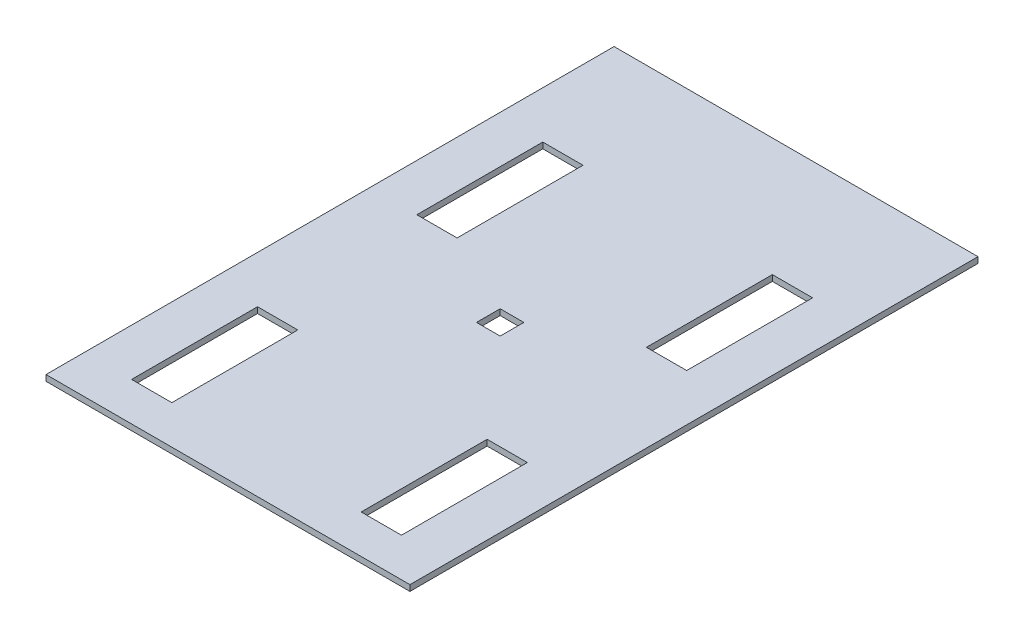
from build123d import *

# Parameters (mm, degrees)
SKETCH1_W           = 390.525
SKETCH1_H           = 609.6
BOSS_EXTRUDE1_DEPTH = 6.35
SKETCH2_W           = 43.18
SKETCH2_H           = 135.128
CUT_EXTRUDE1_DEPTH  = 363.03702353
SKETCH4_W           = 25.4
SKETCH4_H           = 25.4
CUT_EXTRUDE3_DEPTH  = 363.03702353


with BuildPart() as part:
    # Sketch1 → Boss-Extrude1 (new body)
    with BuildSketch(Plane(origin=(0, 0, 0), x_dir=(1, 0, 0), z_dir=(0, 1, 0))):
        Rectangle(SKETCH1_W, SKETCH1_H)
    extrude(amount=BOSS_EXTRUDE1_DEPTH)

    # Sketch2 → Cut-Extrude1 (cut, through all)
    with BuildSketch(Plane(origin=(0, 6.35, 0), x_dir=(1, 0, 0), z_dir=(0, 1, 0))):
        with Locations((123.19, -195.8594)):
            Rectangle(SKETCH2_W, SKETCH2_H)
        with Locations((123.19, 110.236)):
            Rectangle(SKETCH2_W, SKETCH2_H)
        with Locations((-123.19, -195.8594)):
            Rectangle(SKETCH2_W, SKETCH2_H)
        with Locations((-123.19, 110.236)):
            Rectangle(SKETCH2_W, SKETCH2_H)
    extrude(amount=-CUT_EXTRUDE1_DEPTH, mode=Mode.SUBTRACT)

    # Sketch4 → Cut-Extrude3 (cut, through all)
    with BuildSketch(Plane(origin=(0, 0, 0), x_dir=(1, 0, 0), z_dir=(0, 1, 0))):
        with Locations((0, -12.7)):
            Rectangle(SKETCH4_W, SKETCH4_H)
    extrude(amount=CUT_EXTRUDE3_DEPTH, mode=Mode.SUBTRACT)


solid = part.part
